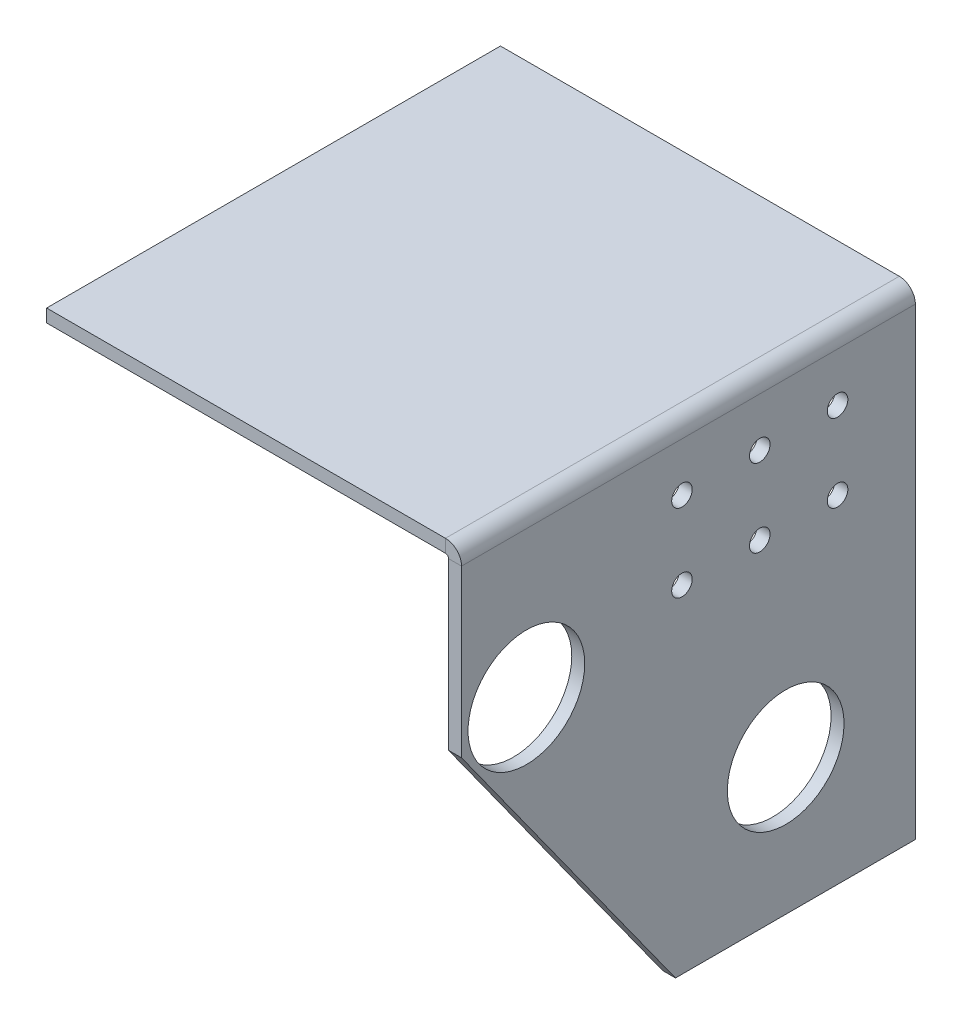
from build123d import *

# Parameters (mm, degrees)
BASE_FLANGE1_DEPTH = 111.125
SKETCH16_R         = 14.2875
SKETCH16_R_2       = 2.5146
CUT_EXTRUDE1_DEPTH = 191.975656171


# Read off the part's stored shape, not the designer's step: Base-Flange1
with BuildPart() as part:
    # Base-Flange1 outline → Base-Flange1 (new body)
    with BuildSketch(Plane.XY):
        with BuildLine():
            Line((98.425, -3.937), (98.425, -117.475))
            Line((98.425, -117.475), (101.6, -117.475))
            Line((101.6, -117.475), (101.6, -3.937))
            ThreePointArc((101.6, -3.937), (100.446879398, -1.153120602), (97.663, 0))
            Line((97.663, 0), (0, 0))
            Line((0, 0), (0, -3.175))
            Line((0, -3.175), (97.663, -3.175))
            ThreePointArc((97.663, -3.175), (98.201815367, -3.398184633), (98.425, -3.937))
        make_face()
    extrude(amount=BASE_FLANGE1_DEPTH)

    # Sketch16 → Cut-Extrude1 (cut, through all)
    with BuildSketch(Plane(origin=(101.6, 0, 0), x_dir=(0, 0, -1), z_dir=(1, 0, 0))):
        with Locations((-31.75, -84.1375)):
            Circle(SKETCH16_R)
        with Locations((-95.25, -39.6875)):
            Circle(SKETCH16_R)
        with Locations((-38.1, -15.875)):
            Circle(SKETCH16_R_2)
        with Locations((-38.1, -34.925)):
            Circle(SKETCH16_R_2)
        with Locations((-57.15, -15.875)):
            Circle(SKETCH16_R_2)
        with Locations((-57.15, -34.925)):
            Circle(SKETCH16_R_2)
        with Locations((-19.05, -15.875)):
            Circle(SKETCH16_R_2)
        with Locations((-19.05, -34.925)):
            Circle(SKETCH16_R_2)
        Polygon((-58.7375, -117.475), (-111.125, -44.592589994), (-111.125, -117.475), align=None)
    extrude(amount=-CUT_EXTRUDE1_DEPTH, mode=Mode.SUBTRACT)


solid = part.part
